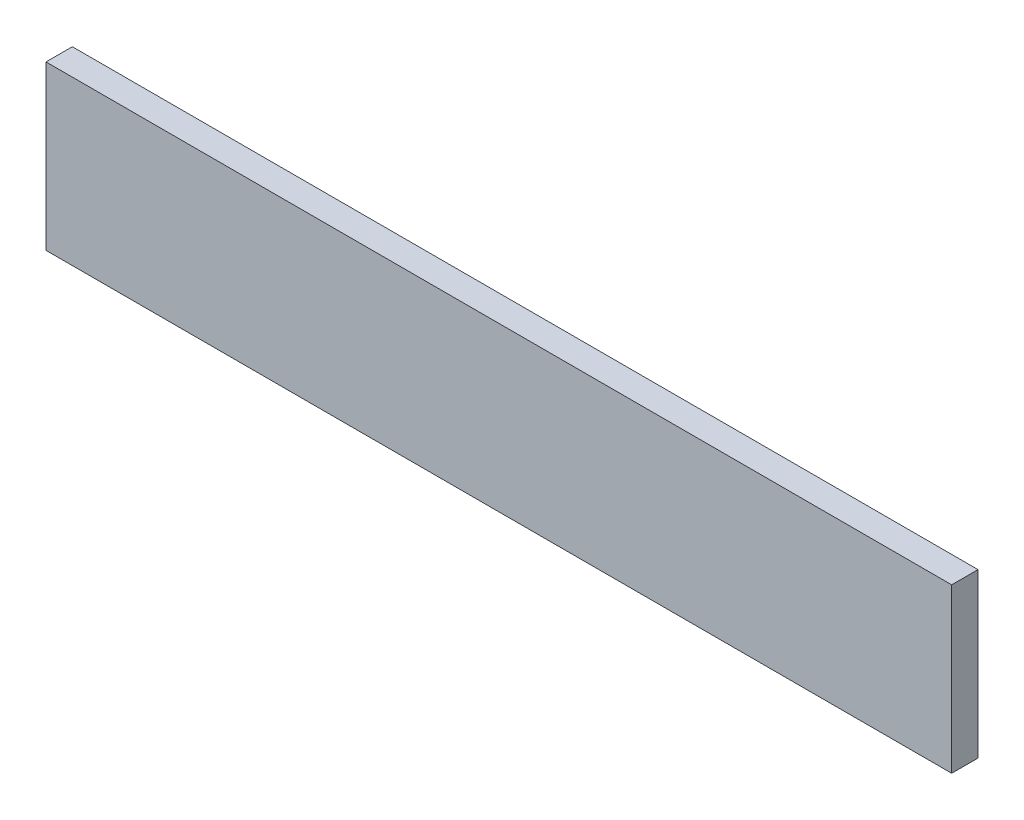
from build123d import *

# Parameters (mm, degrees)
SKETCH1_W           = 860
SKETCH1_H           = 155
BOSS_EXTRUDE1_DEPTH = 25


with BuildPart() as part:
    # Sketch1 → Boss-Extrude1 (new body)
    with BuildSketch(Plane.XY):
        with Locations((430, 77.5)):
            Rectangle(SKETCH1_W, SKETCH1_H)
    extrude(amount=BOSS_EXTRUDE1_DEPTH)


solid = part.part
